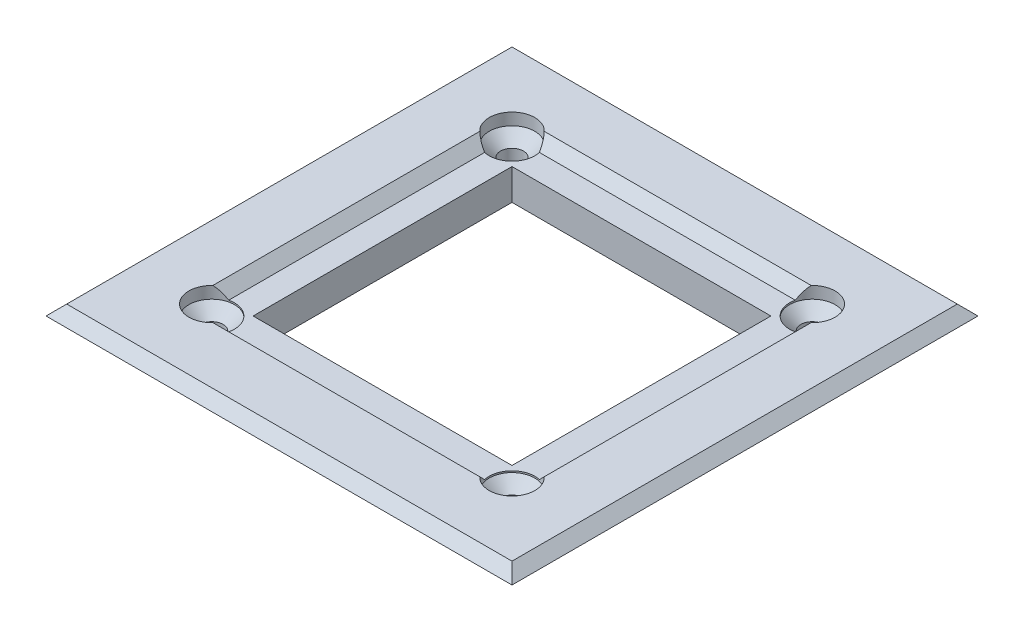
from build123d import *

# Parameters (mm, degrees)
SKETCH1_W                                      = 35
SKETCH1_H                                      = 35
BOSS_EXTRUDE1_DEPTH                            = 3
SKETCH3_W                                      = 25
SKETCH3_H                                      = 25
CUT_EXTRUDE2_DEPTH                             = 25.929901725
SKETCH4_W                                      = 45
SKETCH4_H                                      = 45
SKETCH4_W_2                                    = 30
SKETCH4_H_2                                    = 30
BOSS_EXTRUDE2_DEPTH                            = 1
CHAMFER2_SIZE                                  = 1
CSK_FOR_M2_FLAT_HEAD_MACHINE_SCREW1_AT_2_COUNT = 2
CSK_FOR_M2_FLAT_HEAD_MACHINE_SCREW1_AT_2_PITCH = 29
CSK_FOR_M2_FLAT_HEAD_MACHINE_SCREW1_AT_3_COUNT = 2
CSK_FOR_M2_FLAT_HEAD_MACHINE_SCREW1_AT_3_PITCH = 41.012193309
CSK_FOR_M2_FLAT_HEAD_MACHINE_SCREW1_AT_4_COUNT = 2
CSK_FOR_M2_FLAT_HEAD_MACHINE_SCREW1_AT_4_PITCH = 29
CSK_FOR_M2_FLAT_HEAD_MACHINE_SCREW1_AT_5_COUNT = 2
CSK_FOR_M2_FLAT_HEAD_MACHINE_SCREW1_AT_5_PITCH = 20.506096654
CUT_EXTRUDE3_START                             = 10
SKETCH7_R                                      = 2.2
CUT_EXTRUDE3_DEPTH                             = 10


with BuildPart() as part:
    # Sketch1 → Boss-Extrude1 (new body)
    with BuildSketch(Plane(origin=(0, 0, 0), x_dir=(1, 0, 0), z_dir=(0, 1, 0))):
        Rectangle(SKETCH1_W, SKETCH1_H)
    extrude(amount=BOSS_EXTRUDE1_DEPTH)

    # Sketch3 → Cut-Extrude2 (cut, through all)
    with BuildSketch(Plane(origin=(0, 3, 0), x_dir=(1, 0, 0), z_dir=(0, 1, 0))):
        Rectangle(SKETCH3_W, SKETCH3_H)
    extrude(amount=-CUT_EXTRUDE2_DEPTH, mode=Mode.SUBTRACT)

    # Sketch4 → Boss-Extrude2 (add)
    with BuildSketch(Plane(origin=(0, 3, 0), x_dir=(1, 0, 0), z_dir=(0, 1, 0))):
        Rectangle(SKETCH4_W, SKETCH4_H)
        Rectangle(SKETCH4_W_2, SKETCH4_H_2, mode=Mode.SUBTRACT)
    extrude(amount=BOSS_EXTRUDE2_DEPTH)

    # Chamfer2
    chamfer2_edges = [part.edges().sort_by_distance(p)[0] for p in [
        (0, 4, -15),
        (-15, 4, 0),
        (0, 4, 15),
        (15, 4, 0),
        (0, 4, 22.5),
        (-22.5, 4, 0),
        (0, 4, -22.5),
        (22.5, 4, 0),
    ]]
    chamfer(chamfer2_edges, length=CHAMFER2_SIZE - 0.0001)  # a hair under: the kernel refuses the full size

    # Sketch5 → CSK for M2 Flat Head Machine Screw1 (revolve, cut)
    with BuildSketch(Plane(origin=(14.5, 3, -14.5), x_dir=(0, 0, 1), z_dir=(1, 0, 0))):
        Polygon((0, 0), (0, 20.660946681), (1.1, 20), (1.1, 1.25), (2.2, 0.15), (2.2, 0), align=None)
    csk_for_m2_flat_head_machine_screw1 = revolve(axis=Axis((14.5, 9.35, -14.5), (0, -1, 0)), mode=Mode.SUBTRACT)

    # CSK for M2 Flat Head Machine Screw1 at 2: CSK for M2 Flat Head Machine Screw1 ×2
    with Locations(*[(0, 0, i * CSK_FOR_M2_FLAT_HEAD_MACHINE_SCREW1_AT_2_PITCH) for i in range(1, CSK_FOR_M2_FLAT_HEAD_MACHINE_SCREW1_AT_2_COUNT)]):
        add(csk_for_m2_flat_head_machine_screw1, mode=Mode.SUBTRACT)

    # CSK for M2 Flat Head Machine Screw1 at 3: CSK for M2 Flat Head Machine Screw1 ×2
    with Locations(*[Vector(-0.70710678118655, 0, 0.7071067811865451) * (i * CSK_FOR_M2_FLAT_HEAD_MACHINE_SCREW1_AT_3_PITCH) for i in range(1, CSK_FOR_M2_FLAT_HEAD_MACHINE_SCREW1_AT_3_COUNT)]):
        add(csk_for_m2_flat_head_machine_screw1, mode=Mode.SUBTRACT)

    # CSK for M2 Flat Head Machine Screw1 at 4: CSK for M2 Flat Head Machine Screw1 ×2
    with Locations(*[(-i * CSK_FOR_M2_FLAT_HEAD_MACHINE_SCREW1_AT_4_PITCH, 0, 0) for i in range(1, CSK_FOR_M2_FLAT_HEAD_MACHINE_SCREW1_AT_4_COUNT)]):
        add(csk_for_m2_flat_head_machine_screw1, mode=Mode.SUBTRACT)

    # CSK for M2 Flat Head Machine Screw1 at 5: CSK for M2 Flat Head Machine Screw1 ×2
    with Locations(*[Vector(-0.7071067811865493, 0, 0.7071067811865457) * (i * CSK_FOR_M2_FLAT_HEAD_MACHINE_SCREW1_AT_5_PITCH) for i in range(1, CSK_FOR_M2_FLAT_HEAD_MACHINE_SCREW1_AT_5_COUNT)]):
        add(csk_for_m2_flat_head_machine_screw1, mode=Mode.SUBTRACT)

    # Sketch7 → Cut-Extrude3 (cut)
    with BuildSketch(Plane(origin=(0, 3, 0), x_dir=(1, 0, 0), z_dir=(0, 1, 0)).offset(CUT_EXTRUDE3_START)):
        with Locations(Location((14.5, 14.5, 0), (0, 0, 270))):
            Circle(SKETCH7_R)
        with Locations(Location((14.5, -14.5, 0), (0, 0, 270))):
            Circle(SKETCH7_R)
        with Locations(Location((-14.5, -14.5, 0), (0, 0, 270))):
            Circle(SKETCH7_R)
        with Locations(Location((-14.5, 14.5, 0), (0, 0, 270))):
            Circle(SKETCH7_R)
    extrude(amount=-CUT_EXTRUDE3_DEPTH, mode=Mode.SUBTRACT)


solid = part.part
